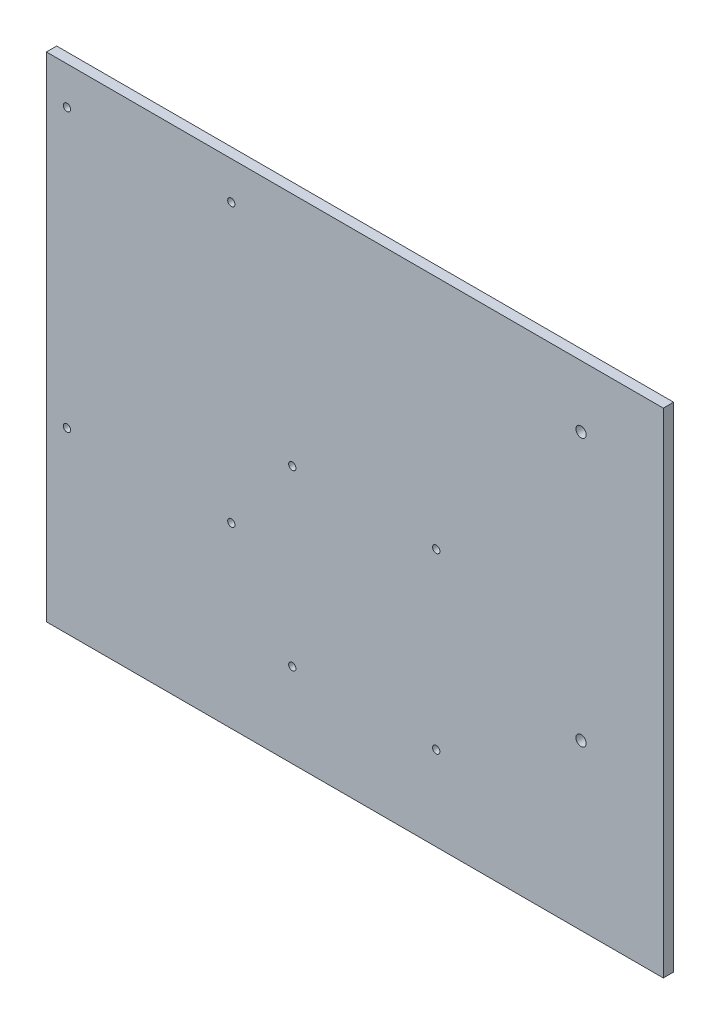
from build123d import *

# Parameters (mm, degrees)
SKETCH1_W            = 381
SKETCH1_H            = 304.8
BOSS_EXTRUDE1_DEPTH  = 6.35
M4_CLEARANCE_HOLE1_D = 4.5
SKETCH3_R            = 3.175
CUT_EXTRUDE2_DEPTH   = 488.959386117
SKETCH8_R            = 2.25425
CUT_EXTRUDE5_DEPTH   = 6.35


with BuildPart() as part:
    # Sketch1 → Boss-Extrude1 (new body)
    with BuildSketch(Plane.XY):
        with Locations((190.5, 152.4)):
            Rectangle(SKETCH1_W, SKETCH1_H)
    extrude(amount=BOSS_EXTRUDE1_DEPTH)

    # M4 Clearance Hole1 (through all)
    with Locations(Plane.XY.offset(6.35)):
        with Locations((12.7, 110), (114.2, 110), (12.7, 281.5), (114.2, 281.5)):
            Hole(M4_CLEARANCE_HOLE1_D / 2)

    # Sketch3 → Cut-Extrude2 (cut, through all)
    with BuildSketch(Plane.XY.offset(6.35)):
        with Locations((330.2, 101.6)):
            Circle(SKETCH3_R)
        with Locations((330.2, 266.7)):
            Circle(SKETCH3_R)
    extrude(amount=-CUT_EXTRUDE2_DEPTH, mode=Mode.SUBTRACT)

    # Sketch8 → Cut-Extrude5 (cut)
    with BuildSketch(Plane(origin=(190.518001872, -5.896320956, 6.35), x_dir=(1, 0, 0), z_dir=(0, 0, 1))):
        with Locations((-38.6718713, 165.095822345)):
            Circle(SKETCH8_R)
        with Locations((50.2281287, 165.095822345)):
            Circle(SKETCH8_R)
        with Locations((-38.6718713, 57.912922015)):
            Circle(SKETCH8_R)
        with Locations((50.2281287, 57.912922015)):
            Circle(SKETCH8_R)
    extrude(amount=-CUT_EXTRUDE5_DEPTH, mode=Mode.SUBTRACT)


solid = part.part
